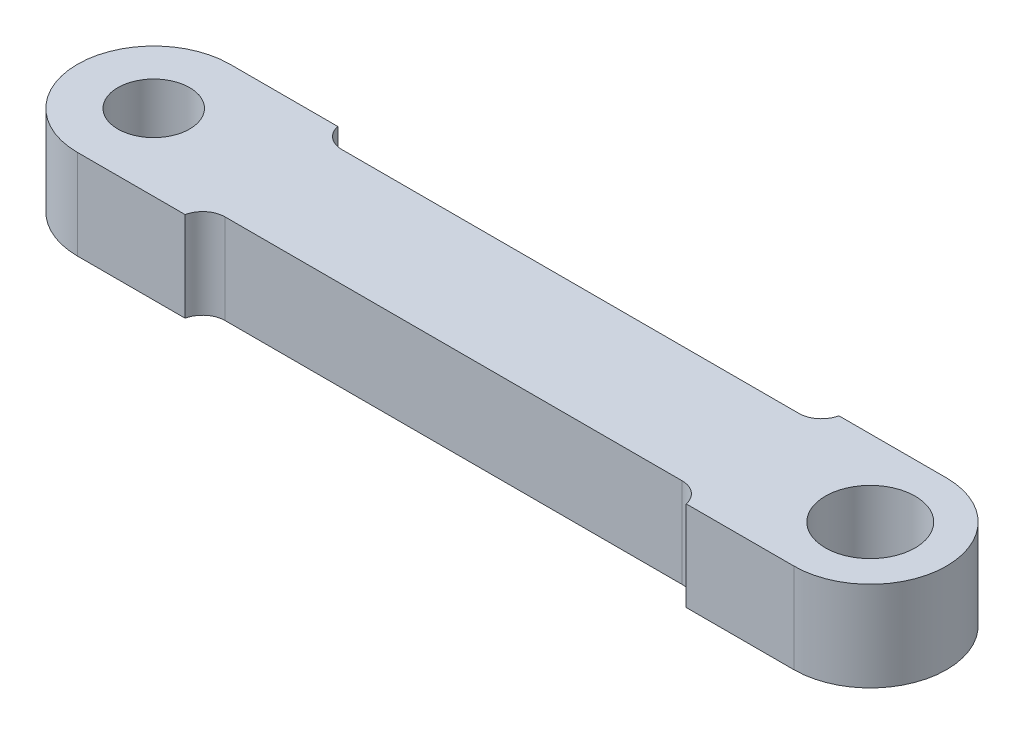
from build123d import *

# Parameters (mm, degrees)
SKETCH1_R           = 50
SKETCH1_R_2         = 40
BOSS_EXTRUDE1_DEPTH = 100
FILLET1_R           = 25


with BuildPart() as part:
    # Sketch1 → Boss-Extrude1 (new body)
    with BuildSketch(Plane(origin=(0, 0, 0), x_dir=(1, 0, 0), z_dir=(0, 1, 0))):
        with BuildLine():
            Line((120, 85), (120, 65))
            Line((120, 65), (678, 65))
            Line((678, 65), (678, 85))
            Line((678, 85), (798, 85))
            ThreePointArc((798, 85), (883, 0), (798, -85))
            Line((798, -85), (678, -85))
            Line((678, -85), (678, -65))
            Line((678, -65), (120, -65))
            Line((120, -65), (120, -85))
            Line((120, -85), (0, -85))
            ThreePointArc((0, -85), (-85, 0), (0, 85))
            Line((0, 85), (120, 85))
        make_face()
        with Locations(Location((798, 0, 0), (0, 0, 270))):
            Circle(SKETCH1_R, mode=Mode.SUBTRACT)
        with Locations(Location((0, 0, 0), (0, 0, 270))):
            Circle(SKETCH1_R_2, mode=Mode.SUBTRACT)
    extrude(amount=BOSS_EXTRUDE1_DEPTH)

    # Fillet1
    # the kernel refuses this fillet: 25 mm, written as the material it adds along each edge
    with BuildSketch(Plane(origin=(120, 0, 65), x_dir=(1, 0, 0), z_dir=(0, 1, 0)), Plane(origin=(678, 0, -65), x_dir=(-1, 0, 0), z_dir=(0, 1, 0))) as fillet1_piece_1:
        with BuildLine():
            CenterArc((24.494897428, -25), FILLET1_R, 90, 78.463040967)
            Line((0, -20), (-0.489897949, -19.9))
            ThreePointArc((-0.489897949, -19.9), (-0.5, -10), (-0.5, 0))
            Line((-0.5, 0), (0, 0.5))
            Line((0, 0.5), (24.494897428, 0.5))
            Line((24.494897428, 0.5), (24.494897428, 0))
        make_face()
    extrude(amount=100)
    with BuildSketch(Plane(origin=(678, 0, 65), x_dir=(0, 0, 1), z_dir=(0, 1, 0)), Plane(origin=(120, 0, -65), x_dir=(0, 0, -1), z_dir=(0, 1, 0))) as fillet1_piece_2:
        with BuildLine():
            CenterArc((25, -24.494897428), FILLET1_R, 101.536959033, 78.463040967)
            Line((0, -24.494897428), (-0.5, -24.494897428))
            Line((-0.5, -24.494897428), (-0.5, 0))
            Line((-0.5, 0), (0, 0.5))
            ThreePointArc((0, 0.5), (10, 0.5), (19.9, 0.489897949))
            Line((19.9, 0.489897949), (20, 0))
        make_face()
    extrude(amount=100)


solid = part.part
